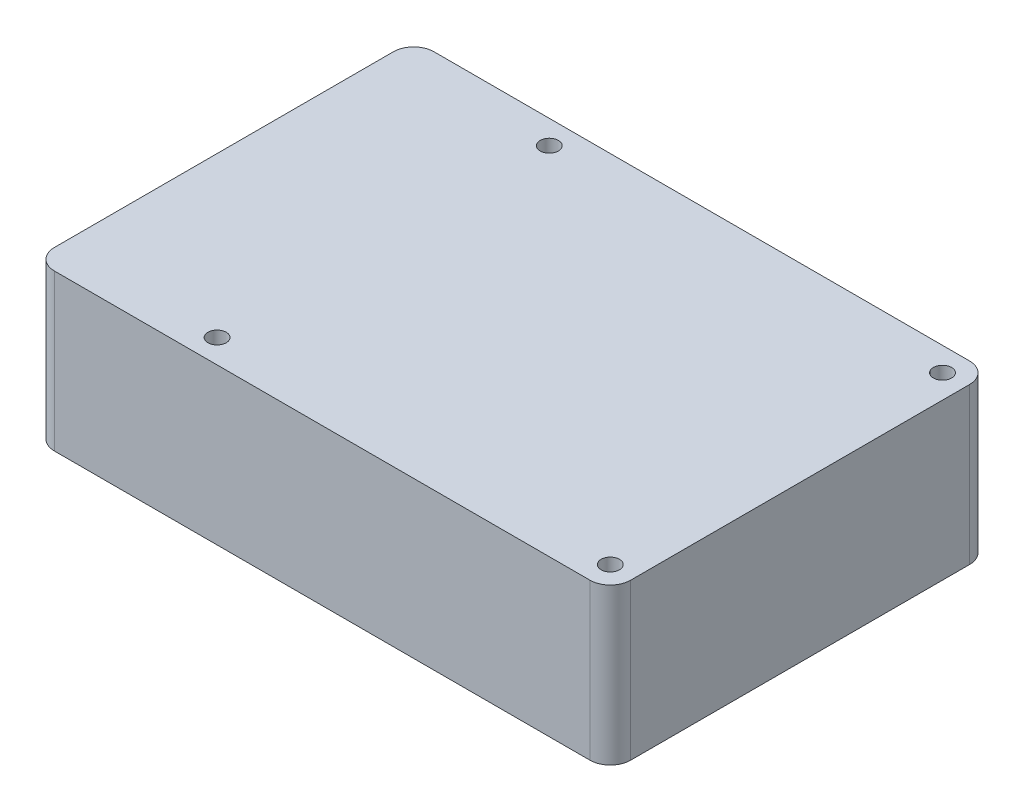
from build123d import *

# Parameters (mm, degrees)
CROQUIS1_W              = 85
CROQUIS1_H              = 56
SALIENTE_EXTRUIR1_DEPTH = 23
REDONDEO1_R             = 3
CROQUIS2_R              = 1.35
CORTAR_EXTRUIR1_DEPTH   = 56.850246195


with BuildPart() as part:
    # Croquis1 → Saliente-Extruir1 (new body)
    with BuildSketch(Plane(origin=(0, 0, 0), x_dir=(1, 0, 0), z_dir=(0, 1, 0))):
        Rectangle(CROQUIS1_W, CROQUIS1_H)
    extrude(amount=SALIENTE_EXTRUIR1_DEPTH)

    # Redondeo1
    redondeo1_edges = [part.edges().sort_by_distance(p)[0] for p in [
        (-42.5, 11.5, -28),
        (42.5, 11.5, -28),
        (-42.5, 11.5, 28),
        (42.5, 11.5, 28),
    ]]
    fillet(redondeo1_edges, radius=REDONDEO1_R)

    # Croquis2 → Cortar-Extruir1 (cut, through all)
    with BuildSketch(Plane(origin=(0, 23, 0), x_dir=(1, 0, 0), z_dir=(0, 1, 0))):
        with Locations((-19, 24.5)):
            Circle(CROQUIS2_R)
        with Locations((39, 24.5)):
            Circle(CROQUIS2_R)
        with Locations((39, -24.5)):
            Circle(CROQUIS2_R)
        with Locations((-19, -24.5)):
            Circle(CROQUIS2_R)
    extrude(amount=-CORTAR_EXTRUIR1_DEPTH, mode=Mode.SUBTRACT)


solid = part.part
